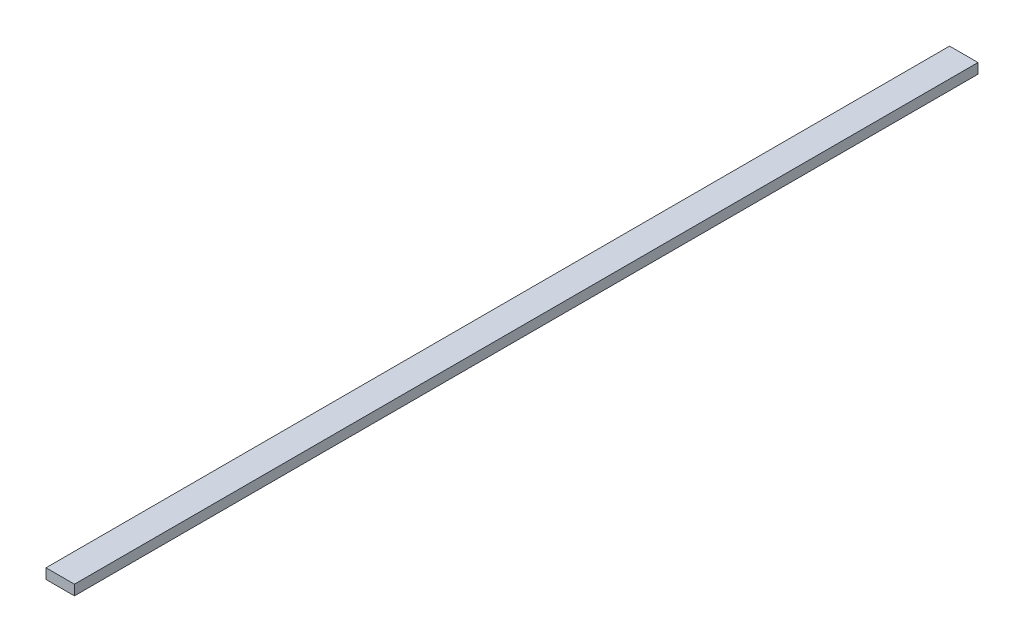
from build123d import *

# Parameters (mm, degrees)
SKIZZE1_W                       = 14
SKIZZE1_H                       = 5
AUFSATZ_LINEAR_AUSTRAGEN1_DEPTH = 445


with BuildPart() as part:
    # Skizze1 → Aufsatz-Linear austragen1 (new body)
    with BuildSketch(Plane.XY):
        with Locations((7, 2.5)):
            Rectangle(SKIZZE1_W, SKIZZE1_H)
    extrude(amount=AUFSATZ_LINEAR_AUSTRAGEN1_DEPTH)


solid = part.part
